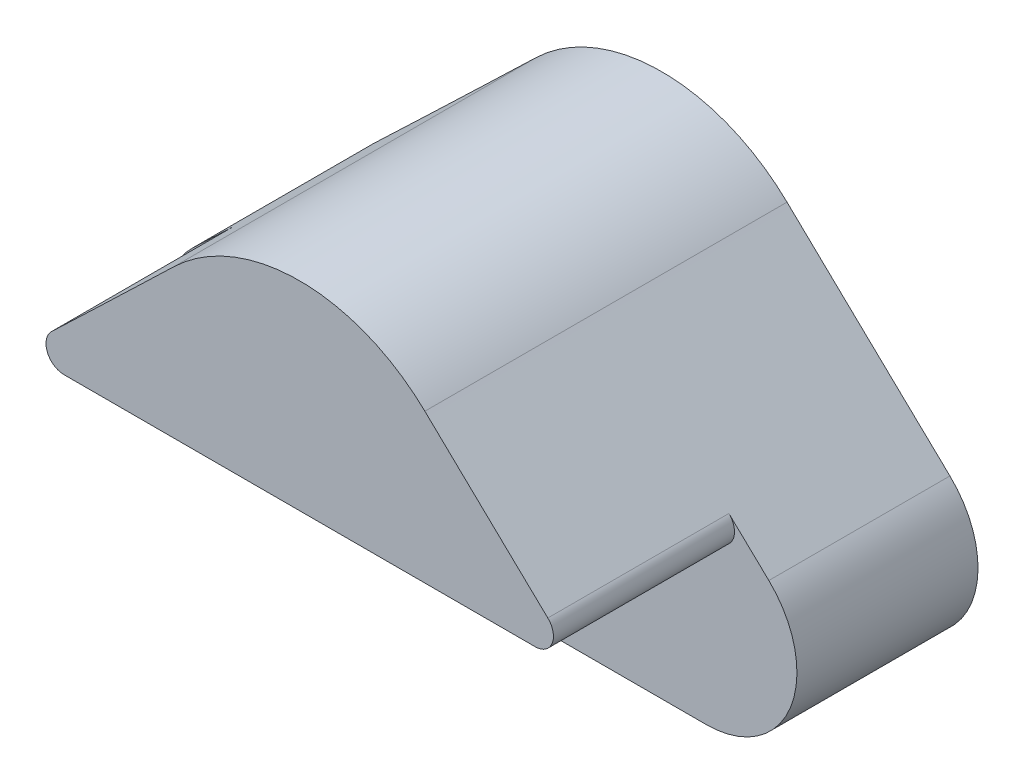
from build123d import *

# Parameters (mm, degrees)
BOSS_EXTRUDE1_DEPTH = 4
SKETCH4_W           = 8
SKETCH4_H           = 1.8
CUT_EXTRUDE2_DEPTH  = 2
FILLET1_R           = 1
FILLET2_R           = 0.2


with BuildPart() as part:
    # Sketch1 → Boss-Extrude1 (new body)
    with BuildSketch(Plane.XY):
        with BuildLine():
            Line((0, 0), (10, 0))
            ThreePointArc((10, 0), (8.189187828, 1.718754897), (6.384188985, 3.443613817))
            ThreePointArc((6.384188985, 3.443613817), (4.997832528, 3.999998826), (3.612685275, 3.440610236))
            ThreePointArc((3.612685275, 3.440610236), (1.811114467, 1.715294636), (0, 0))
        make_face()
    extrude(amount=BOSS_EXTRUDE1_DEPTH)

    # Cut-Extrude1: read off the stored shape, not the designer's step
    # Cut-Extrude1: loft between two sections, ruled curve by curve
    cut_extrude1_from = [
        Edge.make_line((3.279743704, 2.191579296, 0.102519741), (3.279743704, 2.41730023, 0.102519741)),
        Edge.make_line((3.279743704, 2.41730023, 0.102519741), (6.720256296, 2.41730023, 0.102519741)),
        Edge.make_line((6.720256296, 2.41730023, 0.102519741), (6.720256296, 2.191579296, 0.102519741)),
        Edge.make_line((6.720256296, 2.191579296, 0.102519741), (3.279743704, 2.191579296, 0.102519741)),
    ]
    cut_extrude1_to = [
        Edge.make_line((3, 1, 4), (3, 1.8, 4)),
        Edge.make_line((3, 1.8, 4), (7, 1.8, 4)),
        Edge.make_line((7, 1.8, 4), (7, 1, 4)),
        Edge.make_line((7, 1, 4), (3, 1, 4)),
    ]
    cut_extrude1 = Solid(Shell([*[Face.make_surface_from_curves(cut_extrude1_from[k], cut_extrude1_to[k]) for k in range(4)], Face(Wire(cut_extrude1_from)), Face(Wire(cut_extrude1_to))]))
    add(cut_extrude1, mode=Mode.SUBTRACT)

    # Sketch4 → Cut-Extrude2 (cut)
    with BuildSketch(Plane.XY.offset(4)):
        with Locations((4.997832528, 0.9)):
            Rectangle(SKETCH4_W, SKETCH4_H)
    extrude(amount=-CUT_EXTRUDE2_DEPTH, mode=Mode.SUBTRACT)

    # Fillet1
    fillet1_edges = [part.edges().sort_by_distance(p)[0] for p in [
        (0, 0, 2),
        (10, 0, 2),
    ]]
    fillet(fillet1_edges, radius=FILLET1_R)

    # Fillet2
    fillet2_edges = [part.edges().sort_by_distance(p)[0] for p in [
        (1.900031879, 1.8, 3),
        (8.103893685, 1.8, 3),
    ]]
    fillet(fillet2_edges, radius=FILLET2_R)


solid = part.part
